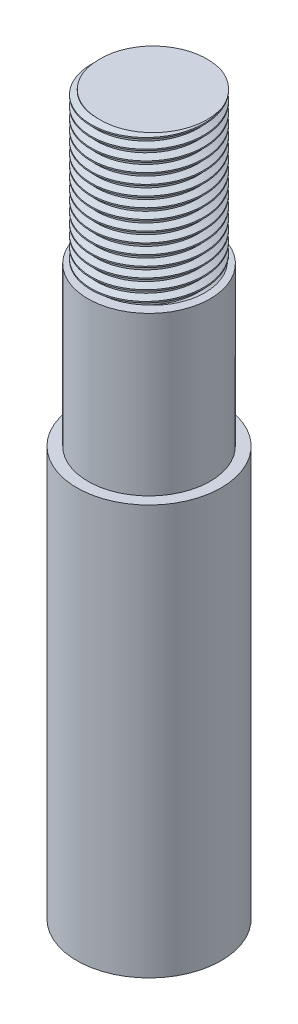
from build123d import *

# Parameters (mm, degrees)
THREAD1_PITCH = 1.411111111
THREAD1_FROM  = 1.058233


with BuildPart() as part:
    # Sketch6 → Revolve1 (revolve)
    with BuildSketch(Plane.XY, mode=Mode.PRIVATE) as revolve1_sk:
        Polygon((0, 0), (-10.05, 0), (-10.05, 57), (-8.5, 57), (-8.5, 79), (-7.07136, 79), (-7.07136, 100), (0, 100), align=None)
    revolve(revolve1_sk.sketch.rotate(Axis((0, 0, 0), (0, 1, 0)), 270), axis=Axis((0, 0, 0), (0, 1, 0)))

    # Thread1: arcs per turn and ends read off the stored shape
    # Thread1: the profile of Thread Profile2 profile screwed along a right-hand helix through 17.007874 turns, 8 arcs to a turn; built about Z, then put on its axis
    thread1_z = Axis((0, 0, 0), (0, 0, 1))
    thread1_corners = [(7.07106, 0, -0.000173206), (7.83514629, 0, 0.44097222), (7.83514629, 0, 0.617361109), (7.07106, 0, 1.058506534)]
    with BuildLine(mode=Mode.PRIVATE) as thread1_profile:
        Line(thread1_corners[0], thread1_corners[1])
        Line(thread1_corners[1], thread1_corners[2])
        Line(thread1_corners[2], thread1_corners[3])
        Line(thread1_corners[3], thread1_corners[0])
    thread1_cap = Face(thread1_profile.wire())
    thread1_turn_angles = [0, 22.5, 45, 67.5, 90, 112.5, 135, 157.5, 180, 202.5, 225, 247.5, 270, 292.5, 315, 337.5, 360]
    thread1_turn_weights = [1, 0.9238795325112867, 1, 0.9238795325112867, 1, 0.9238795325112867, 1, 0.9238795325112867, 1, 0.9238795325112867, 1, 0.9238795325112867, 1, 0.9238795325112867, 1, 0.9238795325112867, 1]
    thread1_turn_rails = [Edge.make_bspline([Vector(p[0], p[1], 0).rotate(thread1_z, thread1_turn_angles[k]) / thread1_turn_weights[k] + Vector(0, 0, p[2] + THREAD1_PITCH * thread1_turn_angles[k] / 360) for k in range(17)], [0, 0, 0, 1, 1, 2, 2, 3, 3, 4, 4, 5, 5, 6, 6, 7, 7, 8, 8, 8], 2, thread1_turn_weights) for p in thread1_corners]
    thread1_turn_sides = [Face.make_surface_from_curves(thread1_turn_rails[p[0]], thread1_turn_rails[p[1]]) for p in [(0, 1), (1, 2), (2, 3), (3, 0)]]
    thread1_last_angles = [6120, 6121.417322835, 6122.834645669]
    thread1_last_weights = [1, 0.999694057253083, 1]
    thread1_last_rails = [Edge.make_bspline([Vector(p[0], p[1], 0).rotate(thread1_z, thread1_last_angles[k]) / thread1_last_weights[k] + Vector(0, 0, p[2] + THREAD1_PITCH * thread1_last_angles[k] / 360) for k in range(3)], [0, 0, 0, 1, 1, 1], 2, thread1_last_weights) for p in thread1_corners]
    thread1_last_sides = [Face.make_surface_from_curves(thread1_last_rails[p[0]], thread1_last_rails[p[1]]) for p in [(0, 1), (1, 2), (2, 3), (3, 0)]]
    thread1 = Plane(origin=(0, 101.058233329, 0), x_dir=(-1, 0, 0), z_dir=(0, -1, 0)) * split(Solid(Shell([*[p.moved(Location((0, 0, THREAD1_PITCH * i))) for i in range(17) for p in thread1_turn_sides], *thread1_last_sides, thread1_cap, thread1_cap.rotate(thread1_z, 6122.834645669).moved(Location((0, 0, THREAD1_PITCH * 6122.834645669 / 360)))])), bisect_by=Plane.XY.offset(THREAD1_FROM), keep=Keep.TOP, mode=Mode.PRIVATE)
    add(thread1)


solid = part.part
